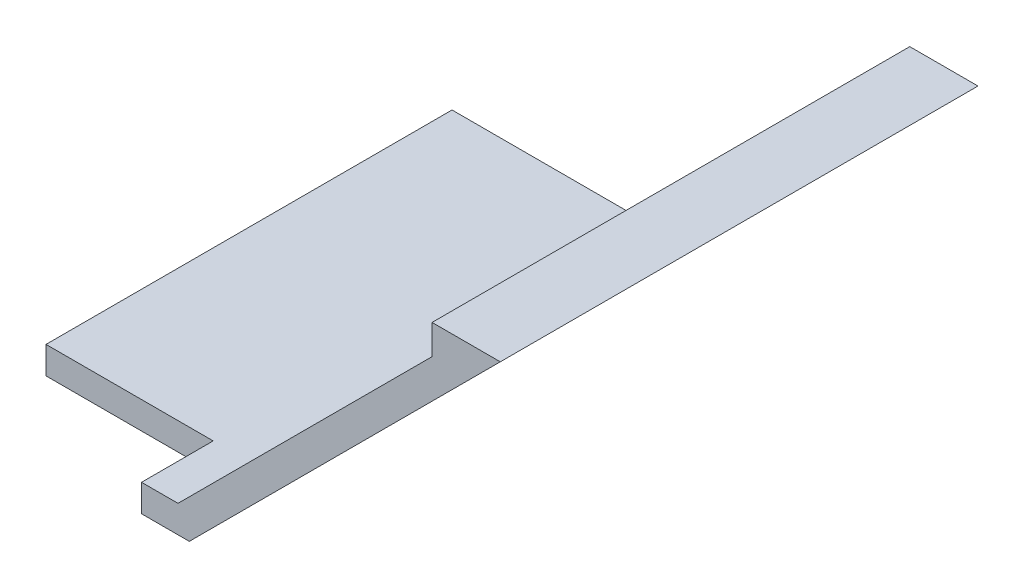
from build123d import *

# Parameters (mm, degrees)
MAIN_EXTRUSION_DEPTH        = 140
LCD_HOLE_SKETCH_W           = 49
LCD_HOLE_SKETCH_H           = 21
LCD_HOLE_DEPTH              = 225.223426519
POWER_BOARD_HOLE_SKETCH_W   = 100
POWER_BOARD_HOLE_SKETCH_H   = 78.90556621
POWER_BOARD_HOLE_DEPTH      = 266.242450078
POWER_BOARD_WINDOW_SKETCH_W = 116
POWER_BOARD_WINDOW_SKETCH_H = 94.90556621
POWER_BOARD_WINDOW_DEPTH    = 5


with BuildPart() as part:
    # Main-Sketch → Main-Extrusion (new body)
    with BuildSketch(Plane.XY):
        Polygon((0, 0), (63, 0), (154.15, 91.15), (134.15, 91.15), (134.15, 82.463708499), (59.686291501, 8), (0, 8), align=None)
    extrude(amount=MAIN_EXTRUSION_DEPTH)

    # Lcd-Hole-Sketch → Lcd-Hole (cut, through all)
    with BuildSketch(Plane(origin=(0, 8, 0), x_dir=(-1, 0, 0), z_dir=(0, 1, 0))):
        with Locations((-24.5, 129.5)):
            Rectangle(LCD_HOLE_SKETCH_W, LCD_HOLE_SKETCH_H)
    extrude(amount=-LCD_HOLE_DEPTH, mode=Mode.SUBTRACT)

    # Power-Board-Hole-Sketch → Power-Board-Hole (cut, through all)
    with BuildSketch(Plane(origin=(22.424380529, -40.575619471, 188.812816497), x_dir=(0, 0, -1), z_dir=(0.707106781186549, -0.7071067811865461, 0))):
        with Locations((118.812816497, 116.835374462)):
            Rectangle(POWER_BOARD_HOLE_SKETCH_W, POWER_BOARD_HOLE_SKETCH_H)
    extrude(amount=-POWER_BOARD_HOLE_DEPTH, mode=Mode.SUBTRACT)

    # Power-Board-Window-Sketch → Power-Board-Window (cut)
    with BuildSketch(Plane(origin=(22.424380529, -40.575619471, 188.812816497), x_dir=(0, 0, -1), z_dir=(0.707106781186549, -0.7071067811865461, 0))):
        with Locations((118.812816497, 116.835374462)):
            Rectangle(POWER_BOARD_WINDOW_SKETCH_W, POWER_BOARD_WINDOW_SKETCH_H)
    extrude(amount=-POWER_BOARD_WINDOW_DEPTH, mode=Mode.SUBTRACT)


solid = part.part
